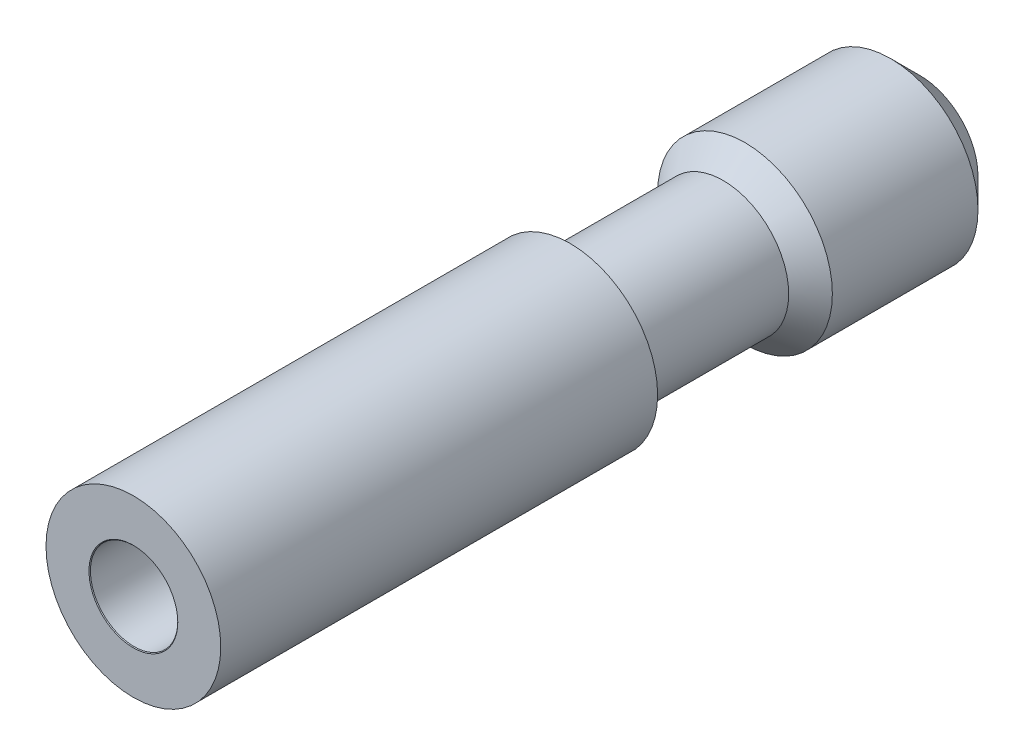
from build123d import *

# Parameters (mm, degrees)
ESQUISSE1_R                             = 3
BOSS_EXTRU_1_DEPTH                      = 27
DIAM_TRE_DU_PER_AGE_3_0_3_1_D           = 3
DIAM_TRE_DU_PER_AGE_3_0_3_1_DEPTH       = 24.5
DIAM_TRE_DU_PER_AGE_3_0_3_1_CSINK_D     = 3.05
DIAM_TRE_DU_PER_AGE_3_0_3_1_CSINK_ANGLE = 90
DIAM_TRE_DU_PER_AGE_3_0_3_1_TIP         = 0.901290929
DIAM_TRE_DU_PER_AGE_2_5_2_5_1_D         = 2.5
DIAM_TRE_DU_PER_AGE_2_5_2_5_1_DEPTH     = 2.5
DIAM_TRE_DU_PER_AGE_2_5_2_5_1_TIP       = 0.751075774
ENL_V_START                             = -15
ESQUISSE8_W                             = 10.37088702
ESQUISSE8_H                             = 7.120487756
ESQUISSE8_R                             = 2.25
ENL_V_MAT_EXTRU_1_DEPTH                 = 6
CHANFREIN1_SIZE                         = 1
CHANFREIN2_SIZE                         = 0.75


with BuildPart() as part:
    # Esquisse1 → Boss.-Extru.1 (new body)
    with BuildSketch(Plane.XY):
        Circle(ESQUISSE1_R)
    extrude(amount=BOSS_EXTRU_1_DEPTH)

    # Diamètre du perçage Ø3.0 (3)1
    with Locations(Plane.XY.offset(27)):
        with Locations((0, 0)):
            CounterSinkHole(DIAM_TRE_DU_PER_AGE_3_0_3_1_D / 2, DIAM_TRE_DU_PER_AGE_3_0_3_1_CSINK_D / 2, depth=DIAM_TRE_DU_PER_AGE_3_0_3_1_DEPTH, counter_sink_angle=DIAM_TRE_DU_PER_AGE_3_0_3_1_CSINK_ANGLE)
            with Locations((0, 0, -(DIAM_TRE_DU_PER_AGE_3_0_3_1_DEPTH + DIAM_TRE_DU_PER_AGE_3_0_3_1_TIP / 2))):  # 118° drill point
                Cone(0, DIAM_TRE_DU_PER_AGE_3_0_3_1_D / 2, DIAM_TRE_DU_PER_AGE_3_0_3_1_TIP, mode=Mode.SUBTRACT)

    # Diamètre du perçage Ø2.5 (2.5)1
    with Locations(Plane(origin=(0, 0, 0), x_dir=(-1, 0, 0), z_dir=(0, 0, -1))):
        with Locations((0, 0)):
            Hole(DIAM_TRE_DU_PER_AGE_2_5_2_5_1_D / 2, depth=DIAM_TRE_DU_PER_AGE_2_5_2_5_1_DEPTH)
            with Locations((0, 0, -(DIAM_TRE_DU_PER_AGE_2_5_2_5_1_DEPTH + DIAM_TRE_DU_PER_AGE_2_5_2_5_1_TIP / 2))):  # 118° drill point
                Cone(0, DIAM_TRE_DU_PER_AGE_2_5_2_5_1_D / 2, DIAM_TRE_DU_PER_AGE_2_5_2_5_1_TIP, mode=Mode.SUBTRACT)

    # Esquisse8 → Enlèv. mat.-Extru.1 (cut)
    with BuildSketch(Plane.XY.offset(27).offset(ENL_V_START)):
        with Locations((-0.50743182, -0.050962128)):
            Rectangle(ESQUISSE8_W, ESQUISSE8_H)
        Circle(ESQUISSE8_R, mode=Mode.SUBTRACT)
    extrude(amount=-ENL_V_MAT_EXTRU_1_DEPTH, mode=Mode.SUBTRACT)

    # Chanfrein1
    chanfrein1_edges = [part.edges().sort_by_distance(p)[0] for p in [
        (-3, 0, 0),
    ]]
    chamfer(chanfrein1_edges, length=CHANFREIN1_SIZE)

    # Chanfrein2
    chanfrein2_edges = [part.edges().sort_by_distance(p)[0] for p in [
        (-2.25, 0, 6),
    ]]
    chamfer(chanfrein2_edges, length=CHANFREIN2_SIZE - 0.0001)  # a hair under: the kernel refuses the full size


solid = part.part
